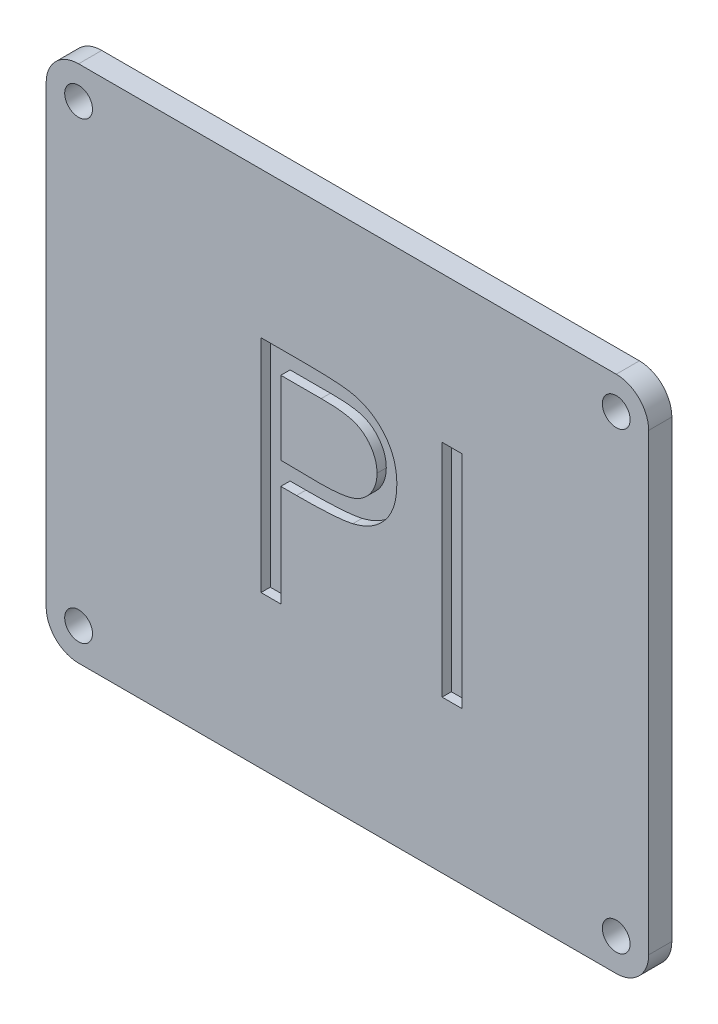
from build123d import *

# Parameters (mm, degrees)
BOSS_EXTRU_1_OUTLINE_W  = 65
BOSS_EXTRU_1_OUTLINE_H  = 56
BOSS_EXTRU_1_OUTLINE_R  = 1.5
BOSS_EXTRU_1_DEPTH      = 2.5
CONG_3_R                = 3.5
ESQUISSE2_W             = 2.137019231
ESQUISSE2_H             = 23.8125
ENL_V_MAT_EXTRU_1_DEPTH = 1


# Read off the part's stored shape, not the designer's step: Boss.-Extru.1
with BuildPart() as part:
    # Boss.-Extru.1 outline → Boss.-Extru.1 (new body)
    with BuildSketch(Plane.XY):
        Rectangle(BOSS_EXTRU_1_OUTLINE_W, BOSS_EXTRU_1_OUTLINE_H)
        with Locations((-29, -24.5)):
            Circle(BOSS_EXTRU_1_OUTLINE_R, mode=Mode.SUBTRACT)
        with Locations((29, -24.5)):
            Circle(BOSS_EXTRU_1_OUTLINE_R, mode=Mode.SUBTRACT)
        with Locations((-29, 24.5)):
            Circle(BOSS_EXTRU_1_OUTLINE_R, mode=Mode.SUBTRACT)
        with Locations((29, 24.5)):
            Circle(BOSS_EXTRU_1_OUTLINE_R, mode=Mode.SUBTRACT)
    extrude(amount=BOSS_EXTRU_1_DEPTH)

    # Congé3
    cong_3_edges = [part.edges().sort_by_distance(p)[0] for p in [
        (-32.5, 28, 1.25),
        (32.5, 28, 1.25),
        (32.5, -28, 1.25),
        (-32.5, -28, 1.25),
    ]]
    fillet(cong_3_edges, radius=CONG_3_R)

    # Esquisse2 → Enlèv. mat.-Extru.1 (cut)
    # profile 1 of 2: a face of its own
    with BuildSketch(Plane.XY.offset(2.5)):
        with BuildLine():
            Line((-9.322744099, 12.249768252), (-4.652784664, 12.249768252))
            add(Edge.make_bspline(
                [(-4.652784664, 12.249768252), (-4.331581892, 12.249415172), (-3.716143116, 12.248738655), (-2.833617469, 12.228227617), (-2.032090545, 12.20083173), (-1.313290632, 12.16285492), (-0.675006107, 12.117974548), (-0.120125194, 12.055027637), (0.355713573, 11.989303126), (0.640827095, 11.922482485), (0.77085566, 11.892008336)],
                knots=[0, 0, 0, 0, 1.415646017, 2.712440637, 3.8905458, 4.950247383, 5.884950622, 6.709939814, 7.411656543, 8, 8, 8, 8], degree=3))
            add(Edge.make_bspline(
                [(0.77085566, 11.892008336), (0.935458095, 11.846955427), (1.260784315, 11.757911225), (1.729557484, 11.579564285), (2.175557754, 11.368094554), (2.600315321, 11.127085249), (2.998610565, 10.846195964), (3.376385951, 10.536812958), (3.730307602, 10.191793179), (4.058385286, 9.815006359), (4.35968007, 9.412777789), (4.61909809, 8.979102974), (4.83631726, 8.521281785), (5.022621303, 8.039632667), (5.156709181, 7.530111002), (5.257721123, 6.996257119), (5.321835447, 6.438128245), (5.32797609, 6.056720932), (5.331102055, 5.86256122)],
                knots=[0, 0, 0, 0, 0.999701418, 1.975846123, 2.934577507, 3.890451536, 4.834027766, 5.787354733, 6.749476667, 7.726910423, 8.712836071, 9.690891519, 10.682875813, 11.679750201, 12.712814741, 13.765529915, 14.8625177, 16, 16, 16, 16], degree=3))
            add(Edge.make_bspline(
                [(5.331102055, 5.86256122), (5.328234861, 5.66676956), (5.322625004, 5.283689954), (5.25529492, 4.723260806), (5.164602009, 4.187694616), (5.025148849, 3.67817889), (4.842502395, 3.197739452), (4.628243964, 2.739034284), (4.369820302, 2.309867231), (4.072879586, 1.908680234), (3.742555345, 1.535096724), (3.380245177, 1.191823926), (2.987411776, 0.880871195), (2.56530359, 0.601541428), (2.109805511, 0.360312098), (1.627825859, 0.144249005), (1.11517528, -0.037209461), (0.760419961, -0.132663986), (0.580050372, -0.181196292)],
                knots=[0, 0, 0, 0, 1.121902311, 2.195077645, 3.232258892, 4.234102512, 5.217864754, 6.176164875, 7.132989551, 8.084763148, 9.034132444, 9.988522005, 10.94243251, 11.903244335, 12.886203696, 13.894208494, 14.929344452, 16, 16, 16, 16], degree=3))
            add(Edge.make_bspline(
                [(0.580050372, -0.181196292), (0.430866189, -0.212921216), (0.103920378, -0.282448234), (-0.434532786, -0.360066485), (-1.061450501, -0.426316947), (-1.775977084, -0.475990758), (-2.577471169, -0.518515586), (-3.466366331, -0.552316368), (-4.444407463, -0.570889123), (-5.126610034, -0.571847017), (-5.482787669, -0.572347133)],
                knots=[0, 0, 0, 0, 0.601384939, 1.31797006, 2.144135048, 3.087295005, 4.142315834, 5.309527816, 6.595305764, 8, 8, 8, 8], degree=3))
            Line((-5.482787669, -0.572347133), (-7.185724869, -0.572347133))
            Line((-7.185724869, -0.572347133), (-7.185724869, -11.562731748))
            Line((-7.185724869, -11.562731748), (-9.322744099, -11.562731748))
            Line((-9.322744099, -11.562731748), (-9.322744099, 12.249768252))
        make_face()
        with BuildLine():
            Line((-7.185724869, 9.807460559), (-7.185724869, 1.869960559))
            Line((-7.185724869, 1.869960559), (-3.016629316, 1.817489105))
            add(Edge.make_bspline(
                [(-3.016629316, 1.817489105), (-2.813066963, 1.817383897), (-2.420094039, 1.817180796), (-1.852429734, 1.844294549), (-1.325770119, 1.875594601), (-0.841732919, 1.921422938), (-0.400099936, 1.986201493), (-0.000134784, 2.051595639), (0.355061194, 2.146201766), (0.770753978, 2.273585505), (1.233963895, 2.490841336), (1.737887752, 2.806186124), (2.16495192, 3.208145942), (2.534510332, 3.660092437), (2.827784252, 4.162870443), (3.042477699, 4.700821602), (3.168623788, 5.268428935), (3.185538784, 5.656832166), (3.194082824, 5.853020956)],
                knots=[0, 0, 0, 0, 1.160613943, 2.240541288, 3.23993089, 4.169200891, 5.011653406, 5.7853311, 6.478053781, 7.106038997, 8.262395093, 9.384106736, 10.481365981, 11.59014053, 12.70357646, 13.786202915, 14.881775077, 16, 16, 16, 16], degree=3))
            add(Edge.make_bspline(
                [(3.194082824, 5.853020956), (3.185492318, 6.044463342), (3.168415456, 6.425027112), (3.041488959, 6.982775465), (2.828201662, 7.515057668), (2.532541618, 8.011535267), (2.173713573, 8.461855522), (1.756659113, 8.853041333), (1.28235996, 9.167513989), (0.841160389, 9.370486852), (0.449266605, 9.49441578), (0.108870592, 9.581126212), (-0.275467747, 9.650356676), (-0.703873532, 9.706414722), (-1.173026277, 9.754403449), (-1.686956598, 9.786965187), (-2.243717635, 9.806025094), (-2.630232412, 9.806970487), (-2.830594159, 9.807460559)],
                knots=[0, 0, 0, 0, 1.120700087, 2.227813068, 3.331159281, 4.466773991, 5.599788987, 6.693661531, 7.80175334, 8.91857717, 9.525282508, 10.207424825, 10.974604443, 11.810962634, 12.737642355, 13.736264703, 14.826523623, 16, 16, 16, 16], degree=3))
            Line((-2.830594159, 9.807460559), (-7.185724869, 9.807460559))
        make_face(mode=Mode.SUBTRACT)
    # profile 2 of 2: a face of its own
    with BuildSketch(Plane.XY.offset(2.5)):
        with Locations((11.284227055, 0.343518252)):
            Rectangle(ESQUISSE2_W, ESQUISSE2_H)
    extrude(amount=-ENL_V_MAT_EXTRU_1_DEPTH, mode=Mode.SUBTRACT)


solid = part.part
